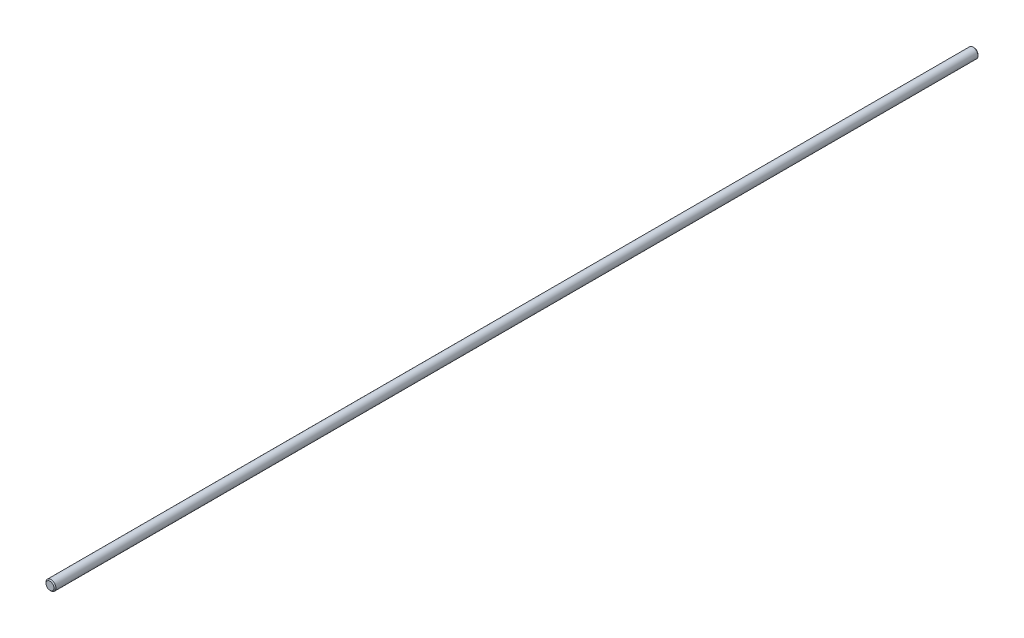
from build123d import *

# Parameters (mm, degrees)
SKETCH1_R           = 2.495
BOSS_EXTRUDE1_DEPTH = 464
CHAMFER1_SIZE       = 0.5


with BuildPart() as part:
    # Sketch1 → Boss-Extrude1 (new body)
    with BuildSketch(Plane.XY):
        Circle(SKETCH1_R)
    extrude(amount=BOSS_EXTRUDE1_DEPTH)

    # Chamfer1
    chamfer1_edges = [part.edges().sort_by_distance(p)[0] for p in [
        (-2.495, 0, 464),
        (-2.495, 0, 0),
    ]]
    chamfer(chamfer1_edges, length=CHAMFER1_SIZE)


solid = part.part
